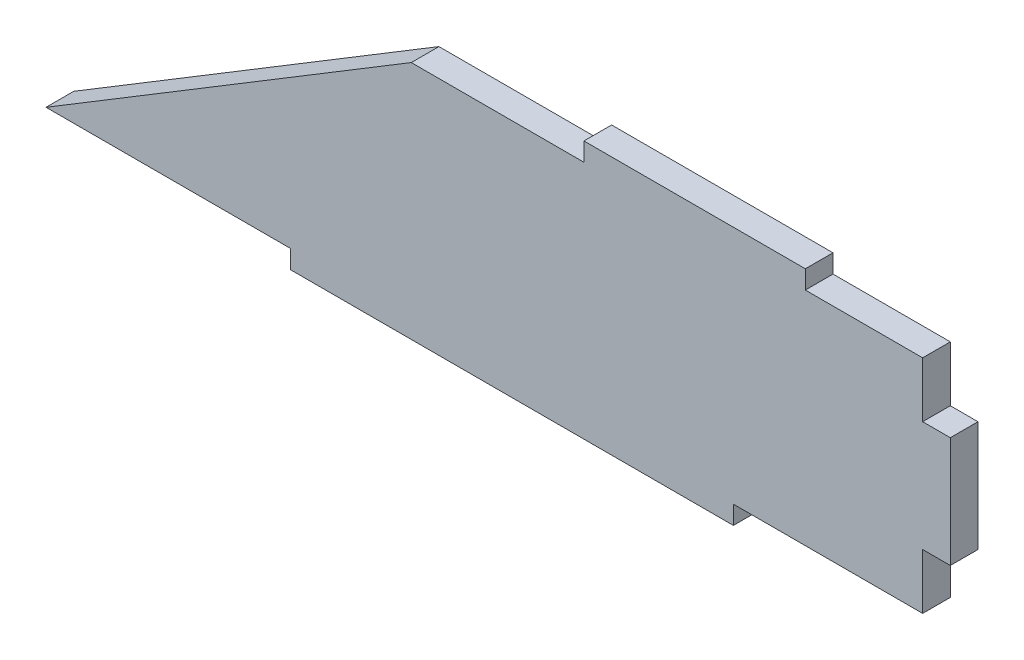
from build123d import *

# Parameters (mm, degrees)
BOSS_EXTRUDE1_DEPTH = 9.525


with BuildPart() as part:
    # Sketch1 → Boss-Extrude1 (new body)
    with BuildSketch(Plane.XY):
        Polygon((138.880411235, 35.070810918), (98.494411235, 35.070810918), (98.494411235, 41.420810918), (22.294411235, 41.420810918), (22.294411235, 35.070810918), (-37.141588765, 35.070810918), (-162.871588765, -41.129189082), (-78.670588765, -41.129189082), (-78.670588765, -47.479189082), (73.729411235, -47.479189082), (73.729411235, -41.129189082), (138.880411235, -41.129189082), (138.880411235, -22.079189082), (148.405411235, -22.079189082), (148.405411235, 16.020810918), (138.880411235, 16.020810918), align=None)
    extrude(amount=BOSS_EXTRUDE1_DEPTH)


solid = part.part
